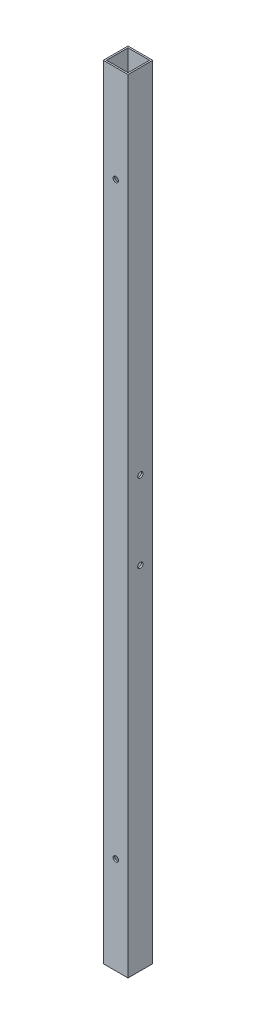
from build123d import *

# Parameters (mm, degrees)
SKETCH1_W           = 15.8
SKETCH1_H           = 15.8
SKETCH1_W_2         = 13.8
SKETCH1_H_2         = 13.8
BOSS_EXTRUDE2_DEPTH = 500
SKETCH4_R           = 1.7
CUT_EXTRUDE2_DEPTH  = 501.311952686
SKETCH6_R           = 1.7
CUT_EXTRUDE3_DEPTH  = 501.311952686


with BuildPart() as part:
    # Sketch1 → Boss-Extrude2 (new body)
    with BuildSketch(Plane(origin=(0, 0, 0), x_dir=(1, 0, 0), z_dir=(0, 1, 0))):
        Rectangle(SKETCH1_W, SKETCH1_H)
        Rectangle(SKETCH1_W_2, SKETCH1_H_2, mode=Mode.SUBTRACT)
    extrude(amount=BOSS_EXTRUDE2_DEPTH)

    # Sketch4 → Cut-Extrude2 (cut, through all)
    with BuildSketch(Plane(origin=(0, 0, -7.9), x_dir=(-1, 0, 0), z_dir=(0, 0, -1))):
        with Locations((-0.094266251, 438)):
            Circle(SKETCH4_R)
        with Locations((-0.094266251, 62)):
            Circle(SKETCH4_R)
    extrude(amount=-CUT_EXTRUDE2_DEPTH, mode=Mode.SUBTRACT)

    # Sketch6 → Cut-Extrude3 (cut, through all)
    with BuildSketch(Plane(origin=(7.9, 0, 0), x_dir=(0, 0, -1), z_dir=(1, 0, 0))):
        with Locations((0, 274.44068925)):
            Circle(SKETCH6_R)
        with Locations((0, 224.44068925)):
            Circle(SKETCH6_R)
    extrude(amount=-CUT_EXTRUDE3_DEPTH, mode=Mode.SUBTRACT)


solid = part.part
